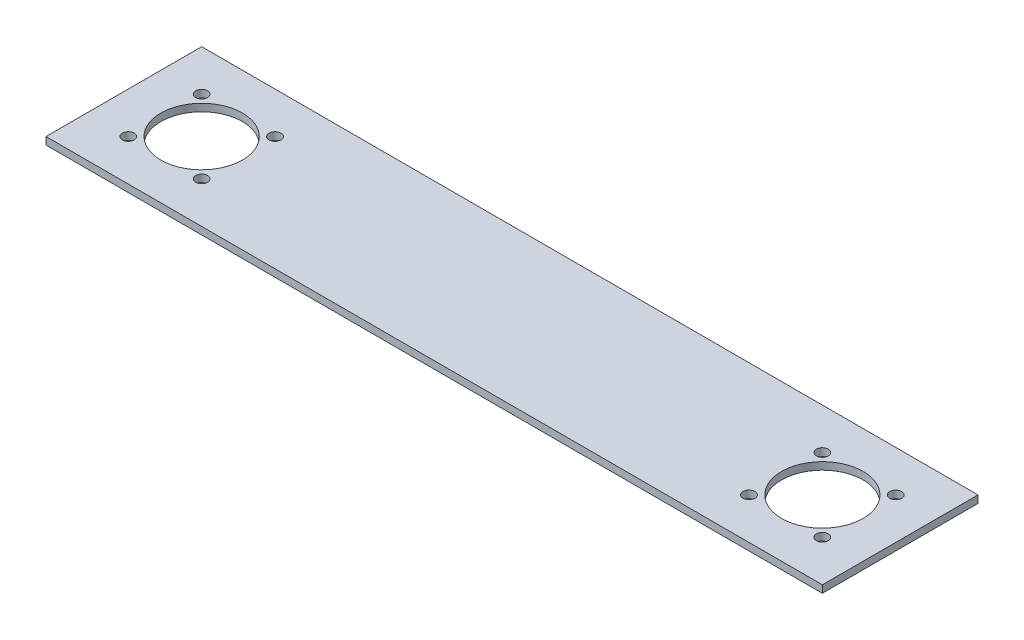
from build123d import *

# Parameters (mm, degrees)
SKETCH1_W           = 209.5
SKETCH1_H           = 42
SKETCH1_R           = 1.6
SKETCH1_R_2         = 11
BOSS_EXTRUDE1_DEPTH = 2


with BuildPart() as part:
    # Sketch1 → Boss-Extrude1 (new body)
    with BuildSketch(Plane(origin=(0, 0, 0), x_dir=(1, 0, 0), z_dir=(0, 1, 0))):
        Rectangle(SKETCH1_W, SKETCH1_H)
        with Locations((-93.649494937, -9.899494937)):
            Circle(SKETCH1_R, mode=Mode.SUBTRACT)
        with Locations((-73.850505063, -9.899494937)):
            Circle(SKETCH1_R, mode=Mode.SUBTRACT)
        with Locations((73.850505063, -9.899494937)):
            Circle(SKETCH1_R, mode=Mode.SUBTRACT)
        with Locations((93.649494937, -9.899494937)):
            Circle(SKETCH1_R, mode=Mode.SUBTRACT)
        with Locations((-83.75, 0)):
            Circle(SKETCH1_R_2, mode=Mode.SUBTRACT)
        with Locations((-93.649494937, 9.899494937)):
            Circle(SKETCH1_R, mode=Mode.SUBTRACT)
        with Locations((-73.850505063, 9.899494937)):
            Circle(SKETCH1_R, mode=Mode.SUBTRACT)
        with Locations((83.75, 0)):
            Circle(SKETCH1_R_2, mode=Mode.SUBTRACT)
        with Locations((73.850505063, 9.899494937)):
            Circle(SKETCH1_R, mode=Mode.SUBTRACT)
        with Locations((93.649494937, 9.899494937)):
            Circle(SKETCH1_R, mode=Mode.SUBTRACT)
    extrude(amount=BOSS_EXTRUDE1_DEPTH)


solid = part.part
